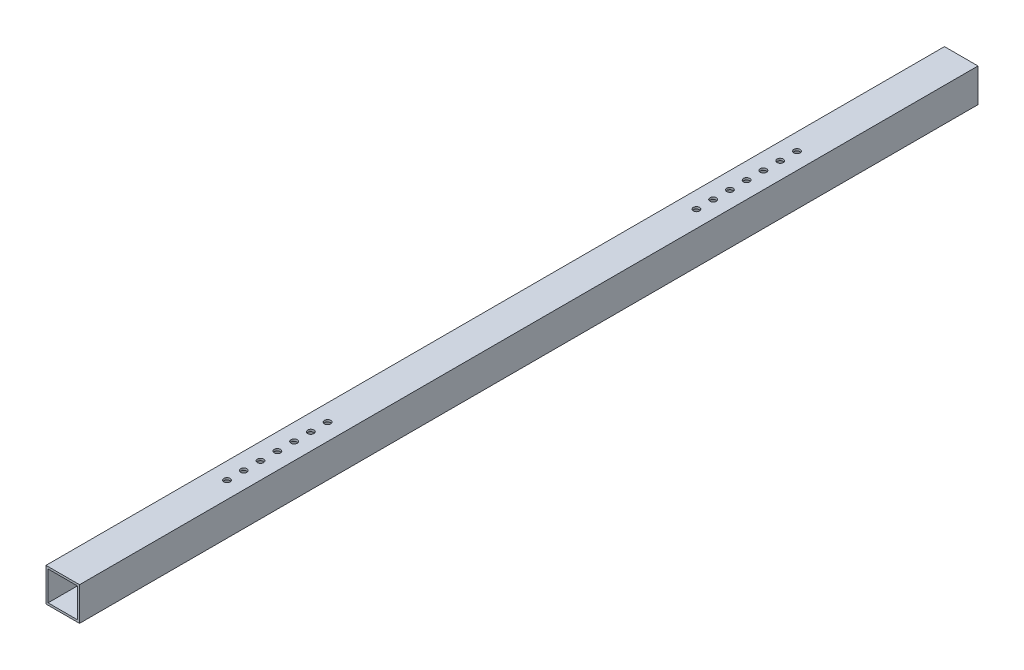
from build123d import *

# Parameters (mm, degrees)
SKETCH1_W           = 25.4
SKETCH1_H           = 25.4
BOSS_EXTRUDE1_DEPTH = 340.36
SKETCH2_W           = 22.225
SKETCH2_H           = 22.225
CUT_EXTRUDE1_DEPTH  = 681.956899077
SKETCH3_R           = 2.38125
CUT_EXTRUDE2_DEPTH  = 342.542646825


with BuildPart() as part:
    # Sketch1 → Boss-Extrude1 (new, symmetric)
    with BuildSketch(Plane.XY):
        Rectangle(SKETCH1_W, SKETCH1_H)
    extrude(amount=BOSS_EXTRUDE1_DEPTH, both=True)

    # Sketch2 → Cut-Extrude1 (cut, through all)
    with BuildSketch(Plane.XY.offset(340.36)):
        Rectangle(SKETCH2_W, SKETCH2_H)
    extrude(amount=-CUT_EXTRUDE1_DEPTH, mode=Mode.SUBTRACT)

    # Sketch3 → Cut-Extrude2 (cut, through all)
    with BuildSketch(Plane(origin=(0, 12.7, 0), x_dir=(1, 0, 0), z_dir=(0, 1, 0))):
        with Locations((0, -215.9)):
            Circle(SKETCH3_R)
        with Locations((0, -203.2)):
            Circle(SKETCH3_R)
        with Locations((0, -190.5)):
            Circle(SKETCH3_R)
        with Locations((0, -177.8)):
            Circle(SKETCH3_R)
        with Locations((0, -165.1)):
            Circle(SKETCH3_R)
        with Locations((0, -152.4)):
            Circle(SKETCH3_R)
        with Locations((0, -139.7)):
            Circle(SKETCH3_R)
        with Locations((0, 139.7)):
            Circle(SKETCH3_R)
        with Locations((0, 152.4)):
            Circle(SKETCH3_R)
        with Locations((0, 165.1)):
            Circle(SKETCH3_R)
        with Locations((0, 177.8)):
            Circle(SKETCH3_R)
        with Locations((0, 190.5)):
            Circle(SKETCH3_R)
        with Locations((0, 215.9)):
            Circle(SKETCH3_R)
        with Locations((0, 203.2)):
            Circle(SKETCH3_R)
    extrude(amount=-CUT_EXTRUDE2_DEPTH, mode=Mode.SUBTRACT)


solid = part.part
